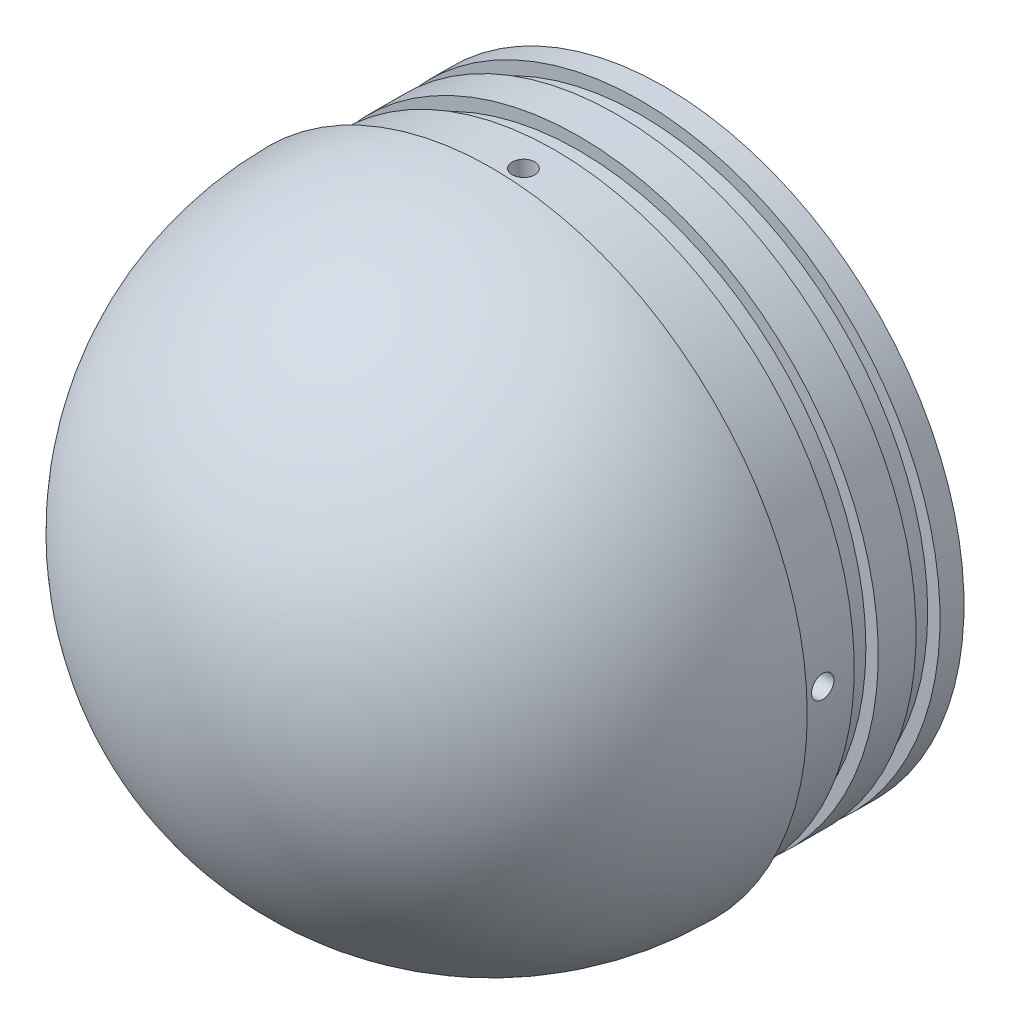
from build123d import *

# Parameters (mm, degrees)
F_4_40_TAPPED_HOLE1_D               = 2.2606
F_4_40_TAPPED_HOLE1_DEPTH           = 7.62
F_4_40_TAPPED_HOLE1_TIP             = 0.679152758
F_4_40_TAPPED_HOLE1_ON_FACE_2_D     = 2.2606
F_4_40_TAPPED_HOLE1_ON_FACE_2_DEPTH = 7.62
F_4_40_TAPPED_HOLE1_ON_FACE_2_TIP   = 0.679152758
F_4_40_TAPPED_HOLE1_ON_FACE_3_D     = 2.2606
F_4_40_TAPPED_HOLE1_ON_FACE_3_DEPTH = 7.62
F_4_40_TAPPED_HOLE1_ON_FACE_3_TIP   = 0.679152758
F_4_40_TAPPED_HOLE1_ON_FACE_4_D     = 2.2606
F_4_40_TAPPED_HOLE1_ON_FACE_4_DEPTH = 7.62
F_4_40_TAPPED_HOLE1_ON_FACE_4_TIP   = 0.679152758
F_10_2_10_2_DIAMETER_HOLE1_D        = 10.2


with BuildPart() as part:
    # Sketch2 → Revolve1 (revolve)
    with BuildSketch(Plane(origin=(0, 0, 0), x_dir=(0, 0, -1), z_dir=(1, 0, 0))):
        Polygon((-17.399, 30.1371), (-11.049, 30.1371), (-11.049, 28.8925), (-8.636, 28.8925), (-8.636, 30.1371), (-4.826, 30.1371), (-4.826, 28.8925), (-2.413, 28.8925), (-2.413, 30.1371), (0, 30.1371), (0, 0), (-14.859, 0), (-14.859, 21.2471), (-17.399, 21.2471), align=None)
    revolve(axis=Axis((0, 0, 0), (0, 0, 1)))

    # #4-40 Tapped Hole1
    with Locations(Plane(origin=(0, -30.1371, 14.224), x_dir=(0, 0, -1), z_dir=(0, -1, 0))):
        with Locations((0, 0)):
            Hole(F_4_40_TAPPED_HOLE1_D / 2, depth=F_4_40_TAPPED_HOLE1_DEPTH)
            with Locations((0, 0, -(F_4_40_TAPPED_HOLE1_DEPTH + F_4_40_TAPPED_HOLE1_TIP / 2))):  # 118° drill point
                Cone(0, F_4_40_TAPPED_HOLE1_D / 2, F_4_40_TAPPED_HOLE1_TIP, mode=Mode.SUBTRACT)

    # #4-40 Tapped Hole1 on face 2
    with Locations(Plane(origin=(30.1371, 0, 14.224), x_dir=(0, 0, 1), z_dir=(1, 0, 0))):
        with Locations((0, 0)):
            Hole(F_4_40_TAPPED_HOLE1_ON_FACE_2_D / 2, depth=F_4_40_TAPPED_HOLE1_ON_FACE_2_DEPTH)
            with Locations((0, 0, -(F_4_40_TAPPED_HOLE1_ON_FACE_2_DEPTH + F_4_40_TAPPED_HOLE1_ON_FACE_2_TIP / 2))):  # 118° drill point
                Cone(0, F_4_40_TAPPED_HOLE1_ON_FACE_2_D / 2, F_4_40_TAPPED_HOLE1_ON_FACE_2_TIP, mode=Mode.SUBTRACT)

    # #4-40 Tapped Hole1 on face 3
    with Locations(Plane(origin=(-30.1371, 0, 14.224), x_dir=(0, 0, -1), z_dir=(-1, 0, 0))):
        with Locations((0, 0)):
            Hole(F_4_40_TAPPED_HOLE1_ON_FACE_3_D / 2, depth=F_4_40_TAPPED_HOLE1_ON_FACE_3_DEPTH)
            with Locations((0, 0, -(F_4_40_TAPPED_HOLE1_ON_FACE_3_DEPTH + F_4_40_TAPPED_HOLE1_ON_FACE_3_TIP / 2))):  # 118° drill point
                Cone(0, F_4_40_TAPPED_HOLE1_ON_FACE_3_D / 2, F_4_40_TAPPED_HOLE1_ON_FACE_3_TIP, mode=Mode.SUBTRACT)

    # #4-40 Tapped Hole1 on face 4
    with Locations(Plane(origin=(0, 30.1371, 14.224), x_dir=(0, 0, 1), z_dir=(0, 1, 0))):
        with Locations((0, 0)):
            Hole(F_4_40_TAPPED_HOLE1_ON_FACE_4_D / 2, depth=F_4_40_TAPPED_HOLE1_ON_FACE_4_DEPTH)
            with Locations((0, 0, -(F_4_40_TAPPED_HOLE1_ON_FACE_4_DEPTH + F_4_40_TAPPED_HOLE1_ON_FACE_4_TIP / 2))):  # 118° drill point
                Cone(0, F_4_40_TAPPED_HOLE1_ON_FACE_4_D / 2, F_4_40_TAPPED_HOLE1_ON_FACE_4_TIP, mode=Mode.SUBTRACT)

    # Ø10.2 (10.2) Diameter Hole1 (through all)
    with Locations(Plane.XY.offset(14.859)):
        with Locations((0, 0)):
            Hole(F_10_2_10_2_DIAMETER_HOLE1_D / 2)

    # Sketch6 → Revolve2 (revolve)
    with BuildSketch(Plane(origin=(0, 0, 0), x_dir=(1, 0, 0), z_dir=(0, 1, 0))):
        with BuildLine():
            Line((0, -17.399), (31.75, -17.399))
            ThreePointArc((31.75, -17.399), (22.450640303, -39.849640303), (0, -49.149))
            Line((0, -49.149), (0, -17.399))
        make_face()
    revolve(axis=Axis((0, 0, 17.399), (0, 0, 1)))


solid = part.part
